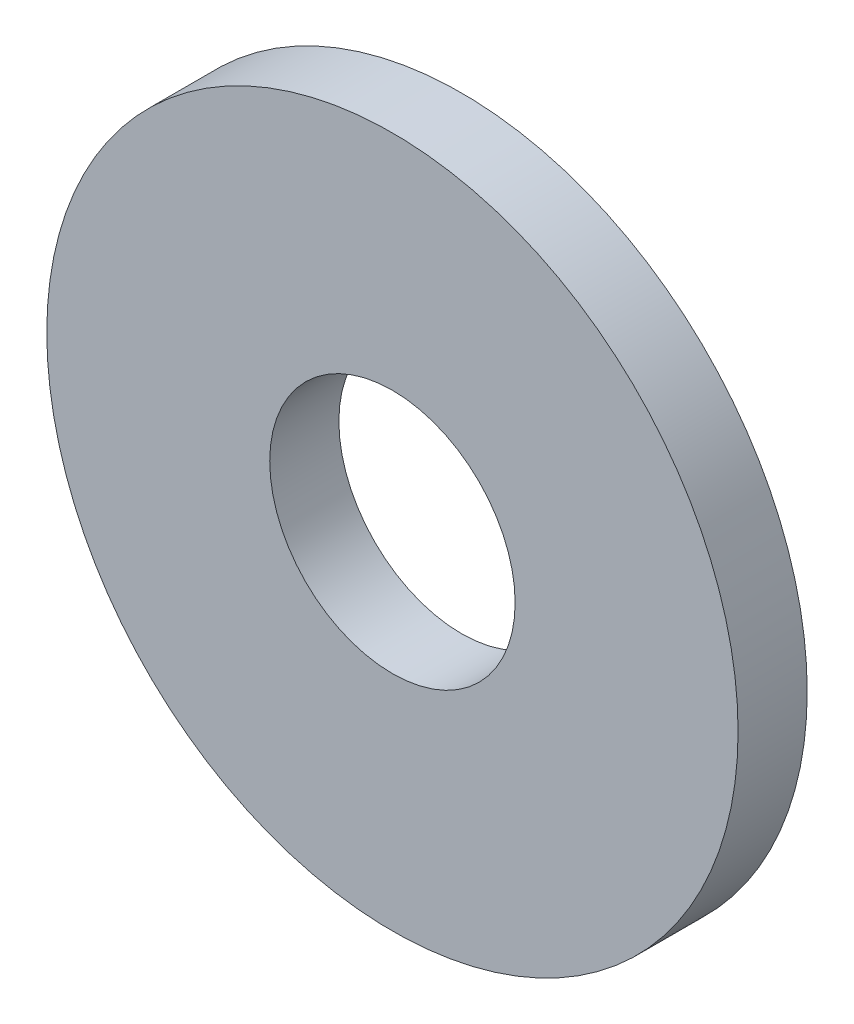
from build123d import *

# Parameters (mm, degrees)
IZIM1_R            = 200
IZIM1_R_2          = 71
TABAN_FLAN_1_DEPTH = 40


# Sheet-metal steps are written as plain solids
with BuildPart() as part:
    # Çizim1 → Taban-Flanş1 (new body)
    with BuildSketch(Plane.XY):
        with Locations((2902.241502802, 1052.867680593)):
            Circle(IZIM1_R)
        with Locations((2902.241502802, 1052.867680593)):
            Circle(IZIM1_R_2, mode=Mode.SUBTRACT)
    extrude(amount=-TABAN_FLAN_1_DEPTH)


solid = part.part
